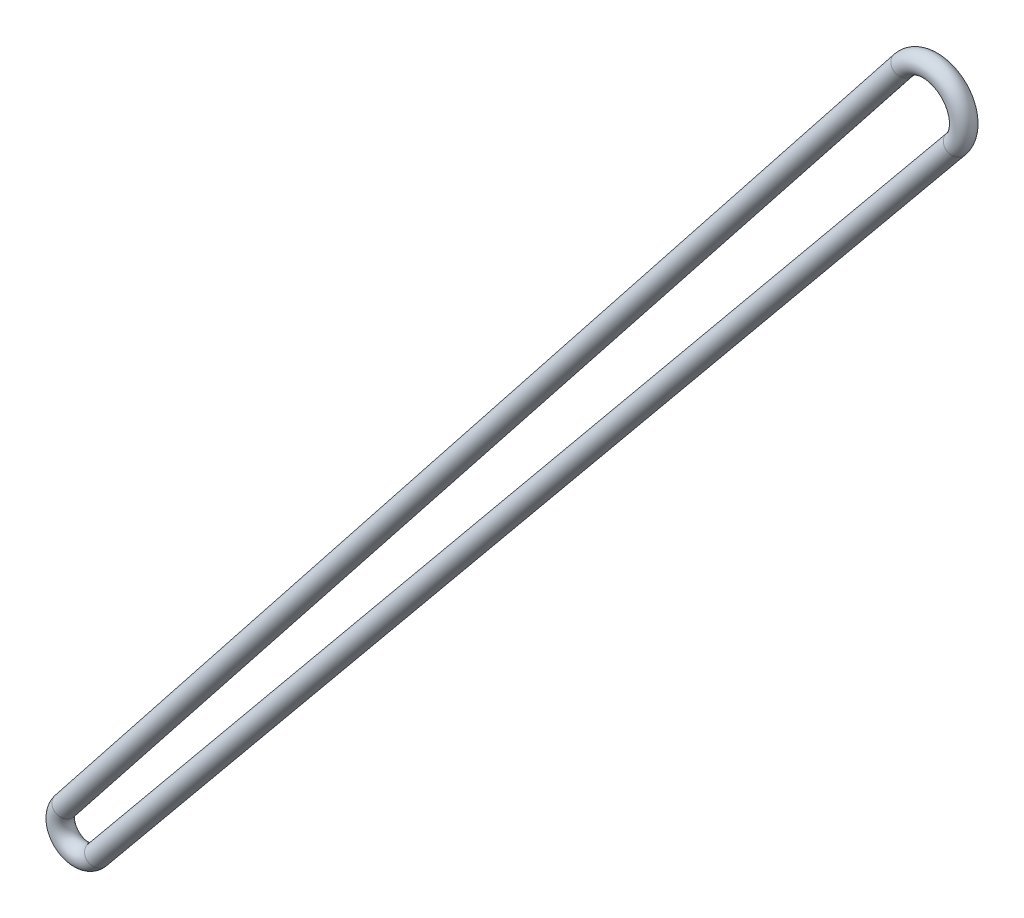
from build123d import *

# Parameters (mm, degrees)
SWEEP_19_PROFILE_R = 1.5


with BuildPart() as part:
    # 扫描19: sweep along a path in 草图2
    with BuildLine(Plane.XY) as sweep_19_path:
        Line((-2.506842811, 1.991912607), (122.00405977, 159.489568815))
        ThreePointArc((122.00405977, 159.489568815), (129.064223575, 160.281556695), (129.789364566, 153.214214316))
        Line((129.789364566, 153.214214316), (2.320046163, -1.898807183))
        ThreePointArc((2.320046163, -1.898807183), (-2.020435262, -2.344160023), (-2.506842811, 1.991912607))
    # 扫描19 profile (on start of the path) → 扫描19 (sweep)
    with BuildSketch(Plane(origin=(-2.506842811, 1.991912607, 0), x_dir=(0.7844692108976411, -0.6201677653293762, 0), z_dir=(0.6201677653293762, 0.7844692108976411, 0))):
        Circle(SWEEP_19_PROFILE_R)
    sweep(path=sweep_19_path.line)


solid = part.part
